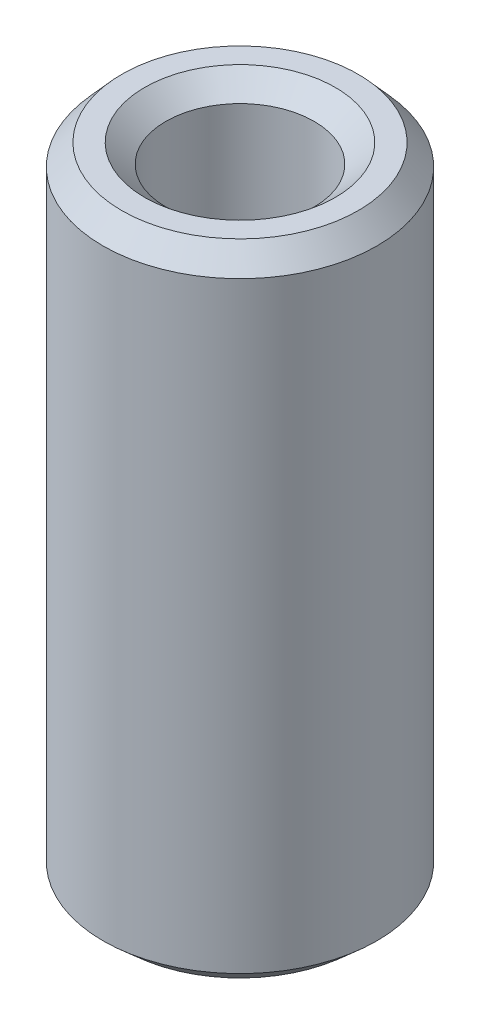
from build123d import *
from OCP.BRepFilletAPI import BRepFilletAPI_MakeChamfer

# Parameters (mm, degrees)
SKETCH1_R           = 20
BOSS_EXTRUDE1_DEPTH = 93.71165406
SKETCH2_R           = 10.829759886
CUT_EXTRUDE1_DEPTH  = 98.887047696
CHAMFER1_SIZE       = 3.092151901
CHAMFER1_SIZE2      = 2.744484639


with BuildPart() as part:
    # Sketch1 → Boss-Extrude1 (new body)
    with BuildSketch(Plane(origin=(0, 0, 0), x_dir=(1, 0, 0), z_dir=(0, 1, 0))):
        Circle(SKETCH1_R)
    extrude(amount=BOSS_EXTRUDE1_DEPTH)

    # Sketch2 → Cut-Extrude1 (cut, through all)
    with BuildSketch(Plane(origin=(0, 0, 0), x_dir=(1, 0, 0), z_dir=(0, 1, 0))):
        Circle(SKETCH2_R)
    extrude(amount=CUT_EXTRUDE1_DEPTH, mode=Mode.SUBTRACT)

    # Chamfer1: one chamfer whose edges measure the first distance from different faces: ONE call of the kernel's chamfer builder (chamfer() names one face for all edges)
    chamfer1_edges_1 = [part.edges().sort_by_distance(p)[0] for p in [
        (-10.829759886, 93.71165406, 0),
    ]]
    chamfer1_side_1 = [part.faces().sort_by_distance(p)[0] for p in [
        (-19.434314575, 93.71165406, 0),
    ]]
    chamfer1_edges_2 = [part.edges().sort_by_distance(p)[0] for p in [
        (-10.829759886, 0, 0),
    ]]
    chamfer1_side_2 = [part.faces().sort_by_distance(p)[0] for p in [
        (-10.829759886, 46.85582703, 0),
    ]]
    chamfer1_edges_3 = [part.edges().sort_by_distance(p)[0] for p in [
        (-20, 0, 0),
    ]]
    chamfer1_side_3 = [part.faces().sort_by_distance(p)[0] for p in [
        (-19.434314575, 0, 0),
    ]]
    chamfer1_edges_4 = [part.edges().sort_by_distance(p)[0] for p in [
        (-20, 93.71165406, 0),
    ]]
    chamfer1_side_4 = [part.faces().sort_by_distance(p)[0] for p in [
        (-20, 46.85582703, 0),
    ]]
    chamfer1 = BRepFilletAPI_MakeChamfer(part.part.solid().wrapped)
    for e in chamfer1_edges_1:
        chamfer1.Add(CHAMFER1_SIZE, CHAMFER1_SIZE2, e.wrapped, chamfer1_side_1[0].wrapped)  # the first distance lies on this face
    for e in chamfer1_edges_2:
        chamfer1.Add(CHAMFER1_SIZE, CHAMFER1_SIZE2, e.wrapped, chamfer1_side_2[0].wrapped)  # the first distance lies on this face
    for e in chamfer1_edges_3:
        chamfer1.Add(CHAMFER1_SIZE, CHAMFER1_SIZE2, e.wrapped, chamfer1_side_3[0].wrapped)  # the first distance lies on this face
    for e in chamfer1_edges_4:
        chamfer1.Add(CHAMFER1_SIZE, CHAMFER1_SIZE2, e.wrapped, chamfer1_side_4[0].wrapped)  # the first distance lies on this face
    add(Compound.cast(chamfer1.Shape()), mode=Mode.REPLACE)


solid = part.part
